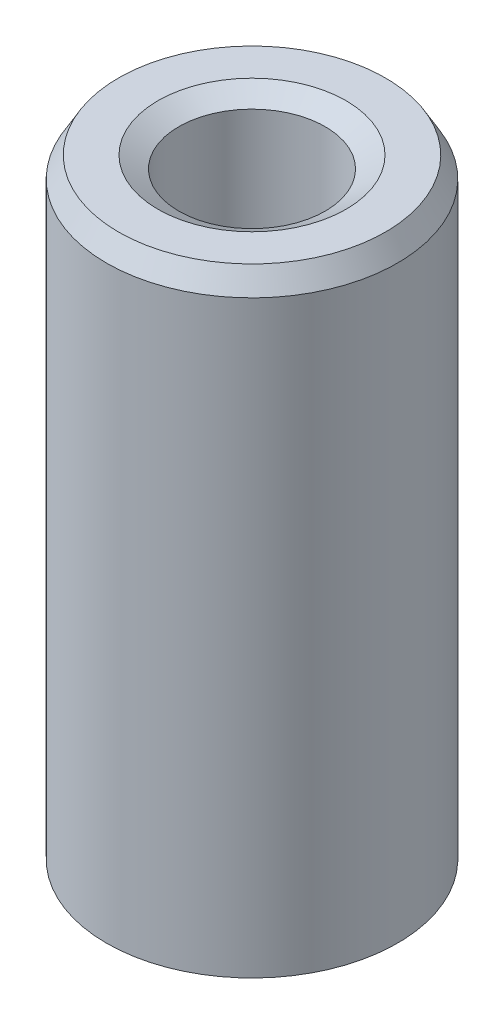
from build123d import *
from OCP.BRepFilletAPI import BRepFilletAPI_MakeChamfer

# Parameters (mm, degrees)
SKETCH1_R           = 25
BOSS_EXTRUDE1_DEPTH = 106.83730176
SKETCH2_R           = 12.57829999
CUT_EXTRUDE1_DEPTH  = 113.535367984
CHAMFER1_SIZE       = 3.583115381
CHAMFER1_SIZE2      = 2.06871263


with BuildPart() as part:
    # Sketch1 → Boss-Extrude1 (new body)
    with BuildSketch(Plane(origin=(0, 0, 0), x_dir=(1, 0, 0), z_dir=(0, 1, 0))):
        Circle(SKETCH1_R)
    extrude(amount=BOSS_EXTRUDE1_DEPTH)

    # Sketch2 → Cut-Extrude1 (cut, through all)
    with BuildSketch(Plane(origin=(0, 0, 0), x_dir=(1, 0, 0), z_dir=(0, 1, 0))):
        Circle(SKETCH2_R)
    extrude(amount=CUT_EXTRUDE1_DEPTH, mode=Mode.SUBTRACT)

    # Chamfer1: one chamfer whose edges measure the first distance from different faces: ONE call of the kernel's chamfer builder (chamfer() names one face for all edges)
    chamfer1_edges_1 = [part.edges().sort_by_distance(p)[0] for p in [
        (-12.57829999, 106.83730176, 0),
    ]]
    chamfer1_side_1 = [part.faces().sort_by_distance(p)[0] for p in [
        (-24.292893219, 106.83730176, 0),
    ]]
    chamfer1_edges_2 = [part.edges().sort_by_distance(p)[0] for p in [
        (-12.57829999, 0, 0),
    ]]
    chamfer1_side_2 = [part.faces().sort_by_distance(p)[0] for p in [
        (-12.57829999, 53.41865088, 0),
    ]]
    chamfer1_edges_3 = [part.edges().sort_by_distance(p)[0] for p in [
        (-25, 0, 0),
    ]]
    chamfer1_side_3 = [part.faces().sort_by_distance(p)[0] for p in [
        (-24.292893219, 0, 0),
    ]]
    chamfer1_edges_4 = [part.edges().sort_by_distance(p)[0] for p in [
        (-25, 106.83730176, 0),
    ]]
    chamfer1_side_4 = [part.faces().sort_by_distance(p)[0] for p in [
        (-25, 53.41865088, 0),
    ]]
    chamfer1 = BRepFilletAPI_MakeChamfer(part.part.solid().wrapped)
    for e in chamfer1_edges_1:
        chamfer1.Add(CHAMFER1_SIZE, CHAMFER1_SIZE2, e.wrapped, chamfer1_side_1[0].wrapped)  # the first distance lies on this face
    for e in chamfer1_edges_2:
        chamfer1.Add(CHAMFER1_SIZE, CHAMFER1_SIZE2, e.wrapped, chamfer1_side_2[0].wrapped)  # the first distance lies on this face
    for e in chamfer1_edges_3:
        chamfer1.Add(CHAMFER1_SIZE, CHAMFER1_SIZE2, e.wrapped, chamfer1_side_3[0].wrapped)  # the first distance lies on this face
    for e in chamfer1_edges_4:
        chamfer1.Add(CHAMFER1_SIZE, CHAMFER1_SIZE2, e.wrapped, chamfer1_side_4[0].wrapped)  # the first distance lies on this face
    add(Compound.cast(chamfer1.Shape()), mode=Mode.REPLACE)


solid = part.part
